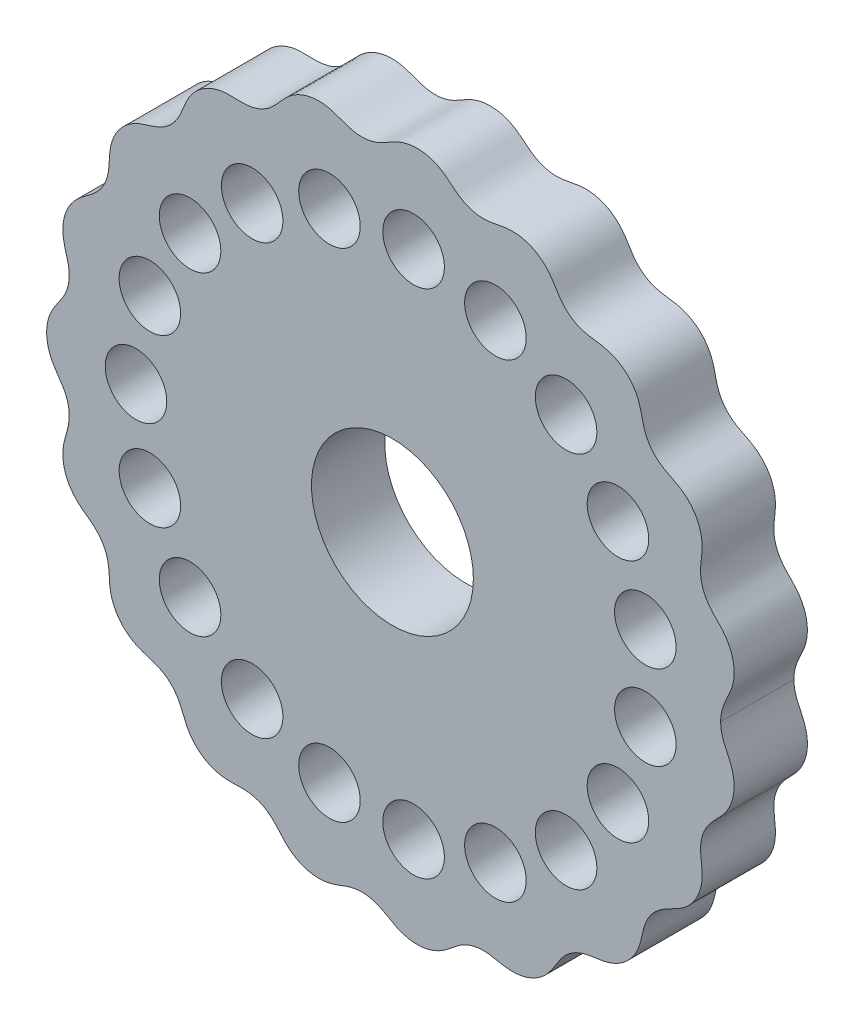
from build123d import *

# Parameters (mm, degrees)
BOSS_EXTRUDE1_DEPTH = 10
SKETCH5_R           = 11.05
CUT_EXTRUDE3_DEPTH  = 10
SKETCH6_R           = 4.2
CUT_EXTRUDE4_DEPTH  = 68.398233432
CIRPATTERN1_COUNT   = 19


with BuildPart() as part:
    # Sketch4 → Boss-Extrude1 (new body)
    with BuildSketch(Plane.XY):
        with BuildLine():
            add(Edge.make_bspline(
                [(44.800003284, 0), (44.800005514, -0.318061583), (44.848123453, -0.950162976), (45.039598761, -1.777104396), (45.44738729, -2.749451158), (45.869218624, -3.593611071), (46.212388189, -4.361399398), (46.493033718, -5.234108609), (46.658348243, -6.212891589), (46.661099821, -7.281742887), (46.459800604, -8.407226471), (46.082249544, -9.420803713), (45.57279839, -10.302375761), (44.979241981, -11.050472224), (44.355353639, -11.686682404), (43.678631361, -12.362854282), (43.028344658, -13.15661411), (42.480825806, -14.123325011), (42.17010335, -15.116569173), (42.05695147, -16.008430769), (42.056351594, -16.824524966), (42.116857133, -17.542919907), (42.219443939, -18.312806727), (42.292609296, -19.144185247), (42.273388506, -20.049618817), (42.114794507, -21.013389327), (41.780280334, -22.00666703), (41.243893543, -22.987473855), (40.588031458, -23.805048332), (39.862084328, -24.45862301), (39.110369432, -24.963810723), (38.372048552, -25.353114746), (37.534863545, -25.754207764), (36.642144077, -26.259320137), (35.776776422, -26.957184313), (35.027674349, -27.885977434), (34.527549953, -28.87784717), (34.226433665, -29.858515043), (34.03323046, -30.795412486), (33.837862601, -31.665039747), (33.528932095, -32.568843799), (33.061551164, -33.473469957), (32.411815013, -34.338232161), (31.572849546, -35.114916428), (30.660637928, -35.696183319), (29.722680051, -36.092553933), (28.797554737, -36.330573643), (27.914959021, -36.456207039), (26.965136793, -36.569828705), (25.962048321, -36.784006809), (24.919747194, -37.198128977), (23.911429006, -37.876336955), (23.129370515, -38.699647874), (22.543305337, -39.571224143), (22.067529111, -40.386157655), (21.610681473, -41.092266666), (21.031110782, -41.802511006), (20.299607195, -42.473509827), (19.404122502, -43.057060092), (18.350134143, -43.500188074), (17.294224118, -43.734521684), (16.277381324, -43.786412958), (15.326821587, -43.695485208), (14.453378165, -43.519606897), (13.516877783, -43.32417461), (12.496239714, -43.217337017), (11.387696023, -43.292307579), (10.387391974, -43.579790922), (9.580440439, -43.97618355), (8.898390179, -44.4243701), (8.331138713, -44.869263488), (7.742808417, -45.376300032), (7.085516352, -45.89061093), (6.315354185, -46.367043898), (5.420321603, -46.758040089), (4.404860999, -47.017455049), (3.290076377, -47.100689848), (2.247315776, -46.994886014), (1.304091919, -46.741101243), (0.471290111, -46.385270716), (-0.257399902, -45.978456944), (-1.051294101, -45.497320024), (-1.963940234, -45.028903256), (-3.022918784, -44.690375678), (-4.210711939, -44.576396013), (-5.314057987, -44.70473027), (-6.298707678, -44.992210953), (-7.188314823, -45.343879156), (-8.023945966, -45.654309034), (-8.95041962, -45.88686689), (-9.963782604, -45.986585859), (-11.042840361, -45.911570012), (-12.150880435, -45.629872783), (-13.134739488, -45.180423671), (-13.97742503, -44.608845349), (-14.68041626, -43.962183907), (-15.266852621, -43.290899089), (-15.882265895, -42.558537914), (-16.61262352, -41.838219323), (-17.523226517, -41.202071963), (-18.623101469, -40.739371676), (-19.715939985, -40.535283823), (-20.741498915, -40.51440792), (-21.668692703, -40.559917893), (-22.503252391, -40.569916469), (-23.404928075, -40.484943718), (-24.354855819, -40.257434762), (-25.321545374, -39.85237), (-26.261226476, -39.246827168), (-27.029501471, -38.533923556), (-27.629125746, -37.762928511), (-28.07833655, -36.976565465), (-28.410647273, -36.210985373), (-28.68678962, -35.48505309), (-28.974706337, -34.824120599), (-29.362442975, -34.105999281), (-29.884955507, -33.374396803), (-30.629417194, -32.647108244), (-31.569863268, -32.05553281), (-32.518951933, -31.665336274), (-33.435766343, -31.392125588), (-34.287455574, -31.13032117), (-35.16612806, -30.7563842), (-36.034739755, -30.225159765), (-36.850527185, -29.514974516), (-37.56490779, -28.622278029), (-38.072968665, -27.681893202), (-38.395189392, -26.742990845), (-38.565300394, -25.842182629), (-38.629956344, -25.00364773), (-38.660627174, -24.060476771), (-38.762799052, -23.015132132), (-39.06097413, -21.919454305), (-39.62728113, -20.844372164), (-40.348575642, -19.985597637), (-41.129863488, -19.321109593), (-41.911403327, -18.769513606), (-42.627321587, -18.238152634), (-43.32656987, -17.58728213), (-43.961344842, -16.791062553), (-44.485182088, -15.844702796), (-44.851340564, -14.761638419), (-45.009175535, -13.691577243), (-44.987762928, -12.673574598), (-44.827704817, -11.731991973), (-44.584779233, -10.874457695), (-44.309338282, -9.958413387), (-44.109020042, -8.952160325), (-44.078252739, -7.809217184), (-44.286826979, -6.738738146), (-44.646236657, -5.843527938), (-45.082416932, -5.076106751), (-45.508816726, -4.451181113), (-45.976925321, -3.804672807), (-46.422617543, -3.090150747), (-46.817773556, -2.250147945), (-47.079889604, -1.375910694), (-47.180132255, -0.681639383), (-47.199996309, -0.193180599), (-47.199996136, 0)],
                knots=[0.117696478, 0.117696478, 0.117696478, 0.117696478, 0.117696478, 0.124011499, 0.130246606, 0.134416344, 0.138586082, 0.14275582, 0.146925558, 0.152570896, 0.158216234, 0.163861738, 0.169507242, 0.1739281, 0.178348958, 0.182769816, 0.187190674, 0.192923392, 0.19865611, 0.204679487, 0.207691176, 0.210702865, 0.214840952, 0.218979038, 0.223117125, 0.227255212, 0.232776183, 0.238297155, 0.243818109, 0.249339063, 0.253477956, 0.257616848, 0.261755741, 0.265894633, 0.271916398, 0.277938163, 0.283669831, 0.289401498, 0.293822953, 0.298244409, 0.302665864, 0.30708732, 0.312732729, 0.318378138, 0.324023372, 0.329668606, 0.334090562, 0.338512518, 0.342934474, 0.347356431, 0.353087269, 0.358818108, 0.365053517, 0.371288925, 0.375458456, 0.379627988, 0.383797519, 0.387967051, 0.393612449, 0.399257848, 0.404903326, 0.410548804, 0.414969477, 0.419390149, 0.423810822, 0.428231494, 0.43396457, 0.439697645, 0.445721583, 0.448733552, 0.451745521, 0.455883371, 0.460021222, 0.464159073, 0.468296923, 0.473817851, 0.479338779, 0.484859691, 0.490380602, 0.494519202, 0.498657802, 0.502796401, 0.506935001, 0.512957425, 0.518979849, 0.524710979, 0.530442108, 0.534863887, 0.539285665, 0.543707444, 0.548129222, 0.553774525, 0.559419827, 0.565065188, 0.570710549, 0.575132161, 0.579553773, 0.583975384, 0.588396996, 0.594128401, 0.599859807, 0.605881849, 0.611903891, 0.616042664, 0.620181437, 0.624320209, 0.628458982, 0.633979911, 0.63950084, 0.645021794, 0.650542748, 0.654680708, 0.658818669, 0.662956629, 0.66709459, 0.670106424, 0.673118257, 0.679141924, 0.684874828, 0.690607731, 0.695028491, 0.699449251, 0.703870011, 0.708290772, 0.713936267, 0.719581763, 0.725227137, 0.730872511, 0.735042247, 0.739211984, 0.743381721, 0.747551458, 0.753786508, 0.760021558, 0.765752092, 0.771482626, 0.77590477, 0.780326914, 0.784749058, 0.789171203, 0.794816358, 0.800461513, 0.806106961, 0.811752409, 0.816173719, 0.820595028, 0.825016338, 0.829437647, 0.835169563, 0.840901478, 0.847566949, 0.850899685, 0.85423242, 0.858405316, 0.862578212, 0.866751108, 0.870924004, 0.876786685, 0.880622306, 0.880622306, 0.880622306, 0.880622306, 0.880622306], degree=4))
            add(Edge.make_bspline(
                [(44.800003284, 0), (44.800005514, 0.318061583), (44.848123453, 0.950162976), (45.039598761, 1.777104395), (45.44738729, 2.749451158), (45.869218624, 3.59361107), (46.212388189, 4.361399397), (46.493033718, 5.234108608), (46.658348243, 6.212891588), (46.661099821, 7.281742886), (46.459800604, 8.40722647), (46.082249544, 9.420803712), (45.57279839, 10.30237576), (44.979241981, 11.050472223), (44.355353639, 11.686682403), (43.678631361, 12.362854282), (43.028344658, 13.15661411), (42.480825806, 14.12332501), (42.17010335, 15.116569173), (42.05695147, 16.008430768), (42.056351594, 16.824524965), (42.116857133, 17.542919906), (42.219443939, 18.312806726), (42.292609296, 19.144185246), (42.273388506, 20.049618816), (42.114794507, 21.013389326), (41.780280334, 22.006667029), (41.243893543, 22.987473855), (40.588031458, 23.805048331), (39.862084328, 24.458623009), (39.110369432, 24.963810723), (38.372048552, 25.353114746), (37.534863545, 25.754207764), (36.642144077, 26.259320136), (35.776776422, 26.957184312), (35.027674349, 27.885977433), (34.527549953, 28.877847169), (34.226433665, 29.858515043), (34.03323046, 30.795412485), (33.837862601, 31.665039746), (33.528932095, 32.568843799), (33.061551164, 33.473469956), (32.411815013, 34.33823216), (31.572849546, 35.114916428), (30.660637928, 35.696183318), (29.722680051, 36.092553932), (28.797554737, 36.330573643), (27.914959021, 36.456207039), (26.965136793, 36.569828704), (25.962048321, 36.784006808), (24.919747194, 37.198128976), (23.911429006, 37.876336954), (23.129370515, 38.699647873), (22.543305337, 39.571224142), (22.067529111, 40.386157654), (21.610681473, 41.092266665), (21.031110782, 41.802511005), (20.299607195, 42.473509826), (19.404122502, 43.057060092), (18.350134143, 43.500188073), (17.294224118, 43.734521683), (16.277381324, 43.786412957), (15.326821587, 43.695485207), (14.453378165, 43.519606896), (13.516877783, 43.324174609), (12.496239714, 43.217337016), (11.387696023, 43.292307578), (10.387391974, 43.579790921), (9.580440439, 43.976183549), (8.898390179, 44.424370099), (8.331138713, 44.869263487), (7.742808417, 45.376300031), (7.085516352, 45.890610929), (6.315354185, 46.367043898), (5.420321603, 46.758040088), (4.404860999, 47.017455048), (3.290076377, 47.100689847), (2.247315776, 46.994886013), (1.304091919, 46.741101243), (0.471290111, 46.385270715), (-0.257399902, 45.978456944), (-1.051294101, 45.497320023), (-1.963940234, 45.028903255), (-3.022918784, 44.690375677), (-4.210711939, 44.576396012), (-5.314057987, 44.704730269), (-6.298707678, 44.992210952), (-7.188314823, 45.343879155), (-8.023945966, 45.654309033), (-8.95041962, 45.886866889), (-9.963782604, 45.986585858), (-11.042840361, 45.911570011), (-12.150880435, 45.629872782), (-13.134739488, 45.180423671), (-13.97742503, 44.608845348), (-14.68041626, 43.962183906), (-15.266852621, 43.290899088), (-15.882265895, 42.558537914), (-16.61262352, 41.838219322), (-17.523226517, 41.202071963), (-18.623101469, 40.739371675), (-19.715939985, 40.535283822), (-20.741498915, 40.514407919), (-21.668692703, 40.559917893), (-22.503252391, 40.569916468), (-23.404928075, 40.484943717), (-24.354855819, 40.257434761), (-25.321545374, 39.852369999), (-26.261226476, 39.246827167), (-27.029501471, 38.533923555), (-27.629125746, 37.76292851), (-28.07833655, 36.976565464), (-28.410647273, 36.210985372), (-28.68678962, 35.48505309), (-28.974706337, 34.824120599), (-29.362442975, 34.10599928), (-29.884955507, 33.374396802), (-30.629417194, 32.647108243), (-31.569863268, 32.05553281), (-32.518951933, 31.665336273), (-33.435766343, 31.392125587), (-34.287455574, 31.130321169), (-35.16612806, 30.756384199), (-36.034739755, 30.225159764), (-36.850527185, 29.514974515), (-37.56490779, 28.622278028), (-38.072968665, 27.681893201), (-38.395189392, 26.742990845), (-38.565300394, 25.842182628), (-38.629956344, 25.003647729), (-38.660627174, 24.06047677), (-38.762799052, 23.015132131), (-39.06097413, 21.919454305), (-39.62728113, 20.844372163), (-40.348575642, 19.985597636), (-41.129863488, 19.321109592), (-41.911403327, 18.769513605), (-42.627321587, 18.238152633), (-43.32656987, 17.587282129), (-43.961344842, 16.791062552), (-44.485182088, 15.844702795), (-44.851340564, 14.761638419), (-45.009175535, 13.691577243), (-44.987762928, 12.673574597), (-44.827704817, 11.731991972), (-44.584779233, 10.874457694), (-44.309338282, 9.958413387), (-44.109020042, 8.952160325), (-44.078252739, 7.809217183), (-44.286826979, 6.738738145), (-44.646236657, 5.843527937), (-45.082416932, 5.076106751), (-45.508816726, 4.451181112), (-45.976925321, 3.804672807), (-46.422617543, 3.090150747), (-46.817773556, 2.250147944), (-47.079889604, 1.375910694), (-47.180132255, 0.681639383), (-47.199996309, 0.193180599), (-47.199996136, 0)],
                knots=[0.117696478, 0.117696478, 0.117696478, 0.117696478, 0.117696478, 0.124011499, 0.130246606, 0.134416344, 0.138586082, 0.14275582, 0.146925558, 0.152570896, 0.158216234, 0.163861738, 0.169507242, 0.1739281, 0.178348958, 0.182769816, 0.187190674, 0.192923392, 0.19865611, 0.204679487, 0.207691176, 0.210702865, 0.214840952, 0.218979038, 0.223117125, 0.227255212, 0.232776183, 0.238297155, 0.243818109, 0.249339063, 0.253477956, 0.257616848, 0.261755741, 0.265894633, 0.271916398, 0.277938163, 0.283669831, 0.289401498, 0.293822953, 0.298244409, 0.302665864, 0.30708732, 0.312732729, 0.318378138, 0.324023372, 0.329668606, 0.334090562, 0.338512518, 0.342934474, 0.347356431, 0.353087269, 0.358818108, 0.365053517, 0.371288925, 0.375458456, 0.379627988, 0.383797519, 0.387967051, 0.393612449, 0.399257848, 0.404903326, 0.410548804, 0.414969477, 0.419390149, 0.423810822, 0.428231494, 0.43396457, 0.439697645, 0.445721583, 0.448733552, 0.451745521, 0.455883371, 0.460021222, 0.464159073, 0.468296923, 0.473817851, 0.479338779, 0.484859691, 0.490380602, 0.494519202, 0.498657802, 0.502796401, 0.506935001, 0.512957425, 0.518979849, 0.524710979, 0.530442108, 0.534863887, 0.539285665, 0.543707444, 0.548129222, 0.553774525, 0.559419827, 0.565065188, 0.570710549, 0.575132161, 0.579553773, 0.583975384, 0.588396996, 0.594128401, 0.599859807, 0.605881849, 0.611903891, 0.616042664, 0.620181437, 0.624320209, 0.628458982, 0.633979911, 0.63950084, 0.645021794, 0.650542748, 0.654680708, 0.658818669, 0.662956629, 0.66709459, 0.670106424, 0.673118257, 0.679141924, 0.684874828, 0.690607731, 0.695028491, 0.699449251, 0.703870011, 0.708290772, 0.713936267, 0.719581763, 0.725227137, 0.730872511, 0.735042247, 0.739211984, 0.743381721, 0.747551458, 0.753786508, 0.760021558, 0.765752092, 0.771482626, 0.77590477, 0.780326914, 0.784749058, 0.789171203, 0.794816358, 0.800461513, 0.806106961, 0.811752409, 0.816173719, 0.820595028, 0.825016338, 0.829437647, 0.835169563, 0.840901478, 0.847566949, 0.850899685, 0.85423242, 0.858405316, 0.862578212, 0.866751108, 0.870924004, 0.876786685, 0.880622306, 0.880622306, 0.880622306, 0.880622306, 0.880622306], degree=4))
        make_face()
    extrude(amount=BOSS_EXTRUDE1_DEPTH)

    # Sketch5 → Cut-Extrude3 (cut)
    with BuildSketch(Plane.XY.offset(10)):
        Circle(SKETCH5_R)
    extrude(amount=-CUT_EXTRUDE3_DEPTH, mode=Mode.SUBTRACT)

    # Sketch6 → Cut-Extrude4 (cut, through all)
    with BuildSketch(Plane.XY.offset(10)):
        with Locations((-35, 0)):
            Circle(SKETCH6_R)
    cut_extrude4 = extrude(amount=-CUT_EXTRUDE4_DEPTH, mode=Mode.SUBTRACT)

    # CirPattern1: Cut-Extrude4 ×19 about axis
    cirpattern1_axis = Axis((0, 0, 10), (0, 0, 1))
    for i in range(1, CIRPATTERN1_COUNT):
        add(cut_extrude4.rotate(cirpattern1_axis, i * 360 / CIRPATTERN1_COUNT), mode=Mode.SUBTRACT)


solid = part.part
